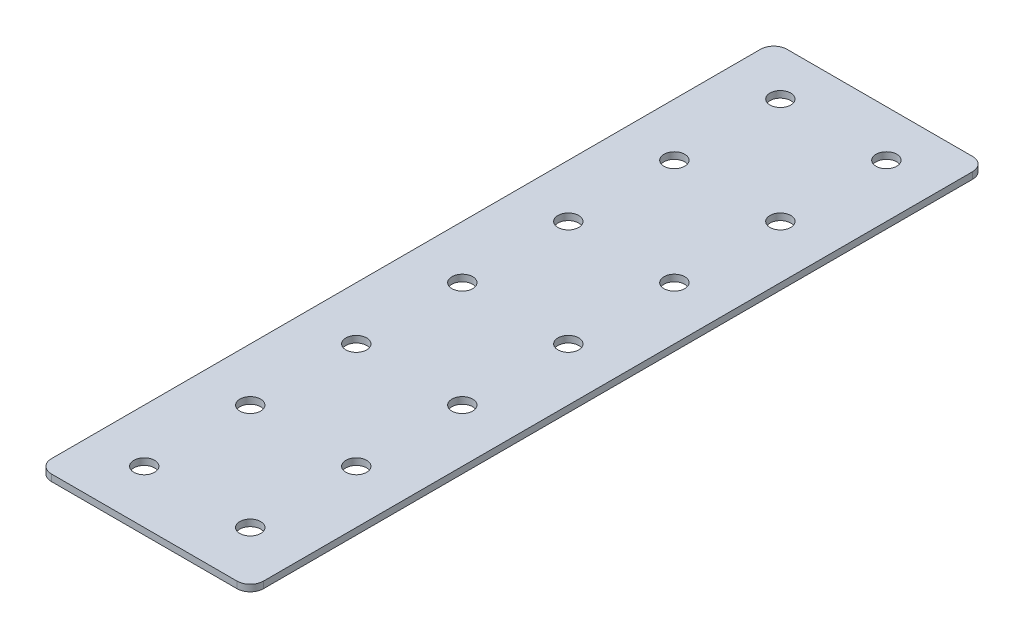
from build123d import *

# Parameters (mm, degrees)
SKETCH1_W           = 50.8
SKETCH1_H           = 176.2125
SKETCH1_R           = 2.4892
BOSS_EXTRUDE1_DEPTH = 1.5875
FILLET1_R           = 3.175


with BuildPart() as part:
    # Sketch1 → Boss-Extrude1 (new body)
    with BuildSketch(Plane(origin=(0, 0, 0), x_dir=(1, 0, 0), z_dir=(0, 1, 0))):
        with Locations((25.4, 88.10625)):
            Rectangle(SKETCH1_W, SKETCH1_H)
        with Locations((12.7, 12.7)):
            Circle(SKETCH1_R, mode=Mode.SUBTRACT)
        with Locations((12.7, 38.1)):
            Circle(SKETCH1_R, mode=Mode.SUBTRACT)
        with Locations((12.7, 63.5)):
            Circle(SKETCH1_R, mode=Mode.SUBTRACT)
        with Locations((12.7, 88.9)):
            Circle(SKETCH1_R, mode=Mode.SUBTRACT)
        with Locations((12.7, 114.3)):
            Circle(SKETCH1_R, mode=Mode.SUBTRACT)
        with Locations((12.7, 139.7)):
            Circle(SKETCH1_R, mode=Mode.SUBTRACT)
        with Locations((38.1, 38.1)):
            Circle(SKETCH1_R, mode=Mode.SUBTRACT)
        with Locations((38.1, 63.5)):
            Circle(SKETCH1_R, mode=Mode.SUBTRACT)
        with Locations((38.1, 88.9)):
            Circle(SKETCH1_R, mode=Mode.SUBTRACT)
        with Locations((38.1, 114.3)):
            Circle(SKETCH1_R, mode=Mode.SUBTRACT)
        with Locations((38.1, 139.7)):
            Circle(SKETCH1_R, mode=Mode.SUBTRACT)
        with Locations((38.1, 12.7)):
            Circle(SKETCH1_R, mode=Mode.SUBTRACT)
        with Locations((12.7, 165.1)):
            Circle(SKETCH1_R, mode=Mode.SUBTRACT)
        with Locations((38.1, 165.1)):
            Circle(SKETCH1_R, mode=Mode.SUBTRACT)
    extrude(amount=BOSS_EXTRUDE1_DEPTH)

    # Fillet1
    fillet1_edges = [part.edges().sort_by_distance(p)[0] for p in [
        (0, 0.79375, -176.2125),
        (50.8, 0.79375, -176.2125),
        (0, 0.79375, 0),
        (50.8, 0.79375, 0),
    ]]
    fillet(fillet1_edges, radius=FILLET1_R)


solid = part.part
